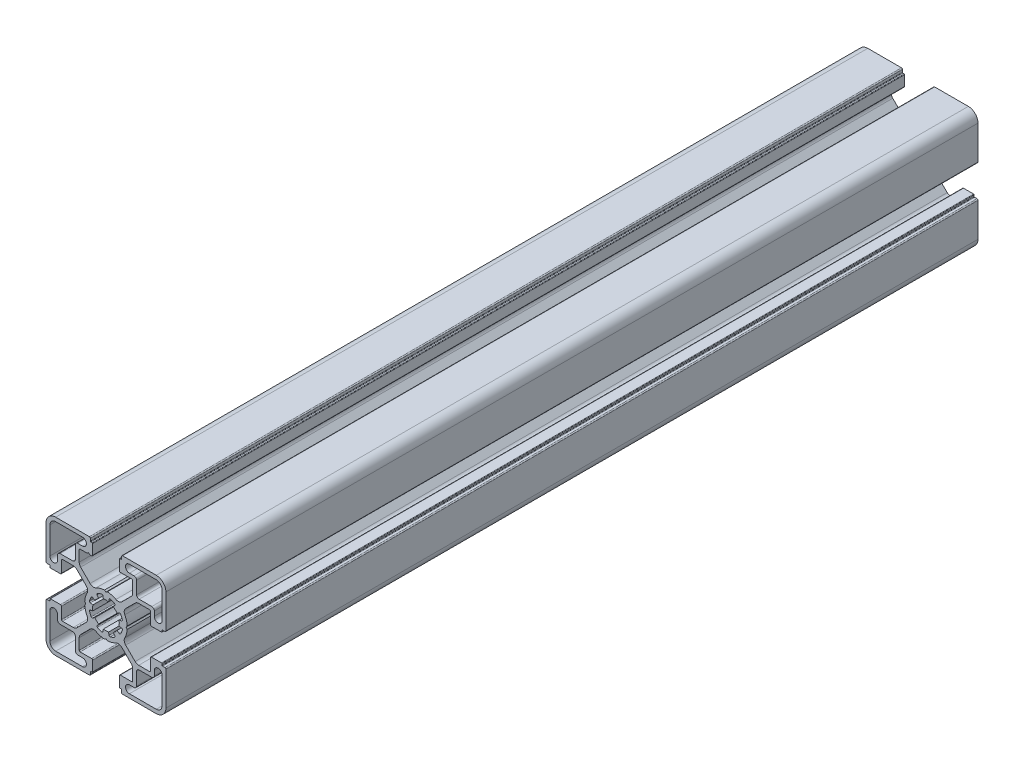
from build123d import *

# Parameters (mm, degrees)
BOSS_EXTRUDE1_DEPTH      = 152.4
FILLET4_R                = 1.885
FILLET5_R                = 0.377
DELETEFACE1_START        = -152.4
DELETEFACE1_DEPTH        = 304.8
CUT_EXTRUDE1_DEPTH       = 156.686415592
CIRPATTERN2_COUNT        = 3
CIRPATTERN2_ANGLE        = 180
FILLET2_R                = 0.377
FILLET3_R                = 0.1885
CUT_EXTRUDE2_DEPTH       = 307.456424309
CUT_EXTRUDE2_DEPTH_BACK  = 307.456424309
SKETCH5_R                = 6.375
BOSS_EXTRUDE2_DEPTH      = 152.4
FILLET6_R                = 0.377
CIRPATTERN1_COUNT        = 8
FILLET6_OF_CIRPATTERN1_R = 0.377
CUT_EXTRUDE3_DEPTH       = 156.686415592
CUT_EXTRUDE3_DEPTH_BACK  = 156.686415592


# Read off the part's stored shape, not the designer's step: DeleteFace1
with BuildPart() as part:
    # Sketch3 → Boss-Extrude1 (new, symmetric)
    with BuildSketch(Plane.XY):
        with BuildLine():
            Line((0, -8), (0, -5))
            ThreePointArc((0, -5), (3.535533906, -3.535533906), (5, 0))
            Line((5, 0), (8, 0))
            ThreePointArc((8, 0), (7.57237156, -2.58054044), (6.335202759, -4.885202759))
            Line((6.335202759, -4.885202759), (11.5, -10.05))
            Line((11.5, -10.05), (16.7, -10.05))
            Line((16.7, -10.05), (16.7, -5))
            Line((16.7, -5), (21.05, -5))
            Line((21.05, -5), (21.05, 0))
            Line((21.05, 0), (22.5, 0))
            Line((22.5, 0), (22.5, -18.875))
            ThreePointArc((22.5, -18.875), (21.438262082, -21.438262082), (18.875, -22.5))
            Line((18.875, -22.5), (0, -22.5))
            Line((0, -22.5), (0, -21.05))
            Line((0, -21.05), (5, -21.05))
            Line((5, -21.05), (5, -16.7))
            Line((5, -16.7), (10.05, -16.7))
            Line((10.05, -16.7), (10.05, -11.5))
            Line((10.05, -11.5), (4.885202759, -6.335202759))
            ThreePointArc((4.885202759, -6.335202759), (2.58054044, -7.57237156), (0, -8))
        make_face()
        with BuildLine():
            Line((18.15, -8.79375), (18.15, -10.5575))
            ThreePointArc((18.15, -10.5575), (17.873948141, -11.223948141), (17.2075, -11.5))
            Line((17.2075, -11.5), (12.4425, -11.5))
            ThreePointArc((12.4425, -11.5), (11.776051859, -11.776051859), (11.5, -12.4425))
            Line((11.5, -12.4425), (11.5, -17.2075))
            ThreePointArc((11.5, -17.2075), (11.223948141, -17.873948141), (10.5575, -18.15))
            Line((10.5575, -18.15), (8.79375, -18.15))
            ThreePointArc((8.79375, -18.15), (7.34375, -19.6), (8.79375, -21.05))
            Line((8.79375, -21.05), (18.875, -21.05))
            ThreePointArc((18.875, -21.05), (20.412957249, -20.412957249), (21.05, -18.875))
            Line((21.05, -18.875), (21.05, -8.79375))
            ThreePointArc((21.05, -8.79375), (19.6, -7.34375), (18.15, -8.79375))
        make_face(mode=Mode.SUBTRACT)
    extrude(amount=BOSS_EXTRUDE1_DEPTH, both=True)

    # Fillet4
    fillet4_edges = [part.edges().sort_by_distance(p)[0] for p in [
        (10.05, -11.5, 0),
        (4.885202759, -6.335202759, 0),
        (6.335202759, -4.885202759, 0),
        (11.5, -10.05, 0),
    ]]
    fillet(fillet4_edges, radius=FILLET4_R)

    # Fillet5
    fillet5_edges = [part.edges().sort_by_distance(p)[0] for p in [
        (5, -21.05, 0),
        (5, -16.7, 0),
        (10.05, -16.7, 0),
        (16.7, -10.05, 0),
        (16.7, -5, 0),
        (21.05, -5, 0),
    ]]
    fillet(fillet5_edges, radius=FILLET5_R)

    # Mirror1: part across plane


with BuildPart() as part_1:
    add(part.part)
    add(part.part.mirror(Plane.ZX))

    # DeleteFace1 outline → DeleteFace1 (cut)
    with BuildSketch(Plane.XY.offset(DELETEFACE1_START)):
        with BuildLine():
            ThreePointArc((4.623, 21.05), (4.889579257, 20.939579257), (5, 20.673))
            Line((5, 20.673), (5, 21.05))
            Line((5, 21.05), (4.623, 21.05))
        make_face()
    extrude(amount=DELETEFACE1_DEPTH, mode=Mode.SUBTRACT)

    # Sketch4 → Cut-Extrude1 (cut, symmetric)
    with BuildSketch(Plane.XY):
        Polygon((5.85, 21.05), (5.85, 22.5), (0, 22.5), (-5.85, 22.5), (-5.85, 21.05), (-5, 21.05), (-5, 16.7), (5, 16.7), (5, 21.05), align=None)
    cut_extrude1 = extrude(amount=CUT_EXTRUDE1_DEPTH, both=True, mode=Mode.SUBTRACT)

    # CirPattern2: Cut-Extrude1 ×3 about axis
    cirpattern2_axis = Axis((0, 0, 117.4), (0, 0, -1))
    for i in range(1, CIRPATTERN2_COUNT):
        add(cut_extrude1.rotate(cirpattern2_axis, i * CIRPATTERN2_ANGLE / (CIRPATTERN2_COUNT - 1)), mode=Mode.SUBTRACT)

    # Fillet2
    fillet2_edges = [part_1.edges().sort_by_distance(p)[0] for p in [
        (5.85, 22.5, 0),
        (22.5, 5.85, 0),
        (22.5, -5.85, 0),
        (5.85, -22.5, 0),
    ]]
    fillet(fillet2_edges, radius=FILLET2_R)

    # Fillet3
    fillet3_edges = [part_1.edges().sort_by_distance(p)[0] for p in [
        (5, 21.05, 0),
        (5.85, 21.05, 0),
        (21.05, -5, 0),
        (21.05, -5.85, 0),
        (21.05, 5, 0),
        (21.05, 5.85, 0),
        (5, -21.05, 0),
        (5.85, -21.05, 0),
    ]]
    fillet(fillet3_edges, radius=FILLET3_R)

    # Mirror2: part across plane


with BuildPart() as part_2:
    add(part_1.part)
    add(part_1.part.mirror(Plane(origin=(0, 0, 0), x_dir=(0, 0, 1), z_dir=(1, 0, 0))))

    # Sketch5 → Cut-Extrude2 (cut, two sides: drawn at the far end of the back side and taken through both)
    with BuildSketch(Plane.XY.offset(152.4).offset(-CUT_EXTRUDE2_DEPTH_BACK)):
        Circle(SKETCH5_R)
        Polygon((-0.580185128, 8), (0.580185128, 8), (0, 7.59375), align=None)
        Polygon((-8, 0.580185128), (-8, -0.580185128), (-7.59375, 0), align=None)
        Polygon((8, 0.580185128), (8, -0.580185128), (7.59375, 0), align=None)
        Polygon((-0.580185128, -8), (0.580185128, -8), (0, -7.59375), align=None)
    extrude(amount=CUT_EXTRUDE2_DEPTH + CUT_EXTRUDE2_DEPTH_BACK, mode=Mode.SUBTRACT)

    # Sketch6 → Boss-Extrude2 (add, symmetric)
    with BuildSketch(Plane.XY):
        with BuildLine():
            Line((-0.97545161, -4.903926402), (-1.243700803, -6.252506163))
            ThreePointArc((-1.243700803, -6.252506163), (0, -6.375), (1.243700803, -6.252506163))
            Line((1.243700803, -6.252506163), (0.97545161, -4.903926402))
            ThreePointArc((0.97545161, -4.903926402), (0, -5), (-0.97545161, -4.903926402))
        make_face()
    boss_extrude2 = extrude(amount=BOSS_EXTRUDE2_DEPTH, both=True)

    # Fillet6
    fillet6_edges = [part_2.edges().sort_by_distance(p)[0] for p in [
        (-1.243700803, -6.252506163, 0),
        (1.243700803, -6.252506163, 0),
    ]]
    fillet(fillet6_edges, radius=FILLET6_R)

    # CirPattern1: Boss-Extrude2 ×8 about axis
    cirpattern1_axis = Axis((0, 0, 0), (0, 0, 1))
    for i in range(1, CIRPATTERN1_COUNT):
        add(boss_extrude2.rotate(cirpattern1_axis, i * 360 / CIRPATTERN1_COUNT))

    # Fillet6 of CirPattern1
    fillet6_of_cirpattern1_edges = [part_2.edges().sort_by_distance(p)[0] for p in [
        (3.541760235, -5.300618778, 0),
        (5.300618778, -3.541760235, 0),
        (6.252506163, -1.243700803, 0),
        (6.252506163, 1.243700803, 0),
        (5.300618778, 3.541760235, 0),
        (3.541760235, 5.300618778, 0),
        (1.243700803, 6.252506163, 0),
        (-1.243700803, 6.252506163, 0),
        (-3.541760235, 5.300618778, 0),
        (-5.300618778, 3.541760235, 0),
        (-6.252506163, 1.243700803, 0),
        (-6.252506163, -1.243700803, 0),
        (-5.300618778, -3.541760235, 0),
        (-3.541760235, -5.300618778, 0),
    ]]
    fillet(fillet6_of_cirpattern1_edges, radius=FILLET6_OF_CIRPATTERN1_R)

    # Sketch7 → Cut-Extrude3 (cut, two sides: drawn at the far end of the back side and taken through both)
    with BuildSketch(Plane.XY.offset(-CUT_EXTRUDE3_DEPTH_BACK)):
        Polygon((-7.031875, 16.7), (-6.596875, 17.135), (-6.161875, 16.7), align=None)
    extrude(amount=CUT_EXTRUDE3_DEPTH + CUT_EXTRUDE3_DEPTH_BACK, mode=Mode.SUBTRACT)


solid = part_2.part
